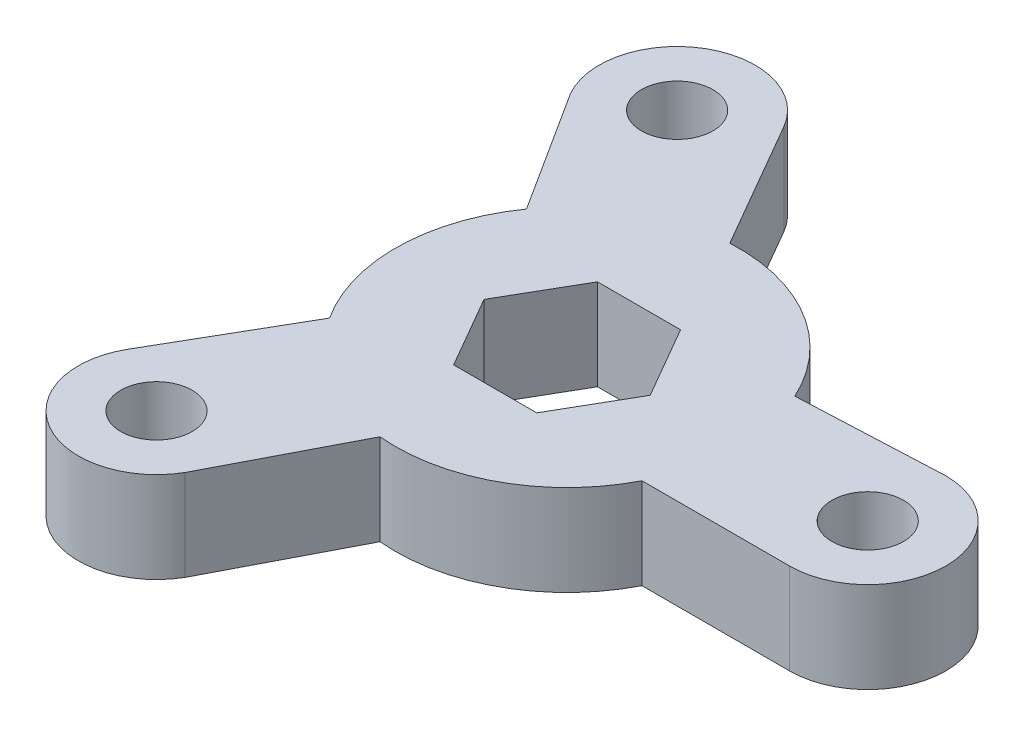
from build123d import *

# Parameters (mm, degrees)
SKETCH1_R           = 1.25
BOSS_EXTRUDE1_DEPTH = 3.175


with BuildPart() as part:
    # Sketch1 → Boss-Extrude1 (new body)
    with BuildSketch(Plane(origin=(0, 0, 0), x_dir=(1, 0, 0), z_dir=(0, 1, 0))):
        with BuildLine():
            ThreePointArc((7.969118099, 2.744709812), (5.624188125, 5.376129638), (2.206241257, 6.236772472))
            Line((2.206241257, 6.236772472), (-0.371989304, 10.702398798))
            ThreePointArc((-0.371989304, 10.702398798), (-4.099660205, 11.701225206), (-5.098486612, 7.973554305))
            Line((-5.098486612, 7.973554305), (-2.377479496, 3.718320719))
            ThreePointArc((-2.377479496, 3.718320719), (-3.483890927, 0.371841879), (-2.520256051, -3.018508355))
            Line((-2.520256051, -3.018508355), (-5.098486612, -7.484134681))
            ThreePointArc((-5.098486612, -7.484134681), (-4.099660205, -11.211805582), (-0.371989304, -10.212979174))
            Line((-0.371989304, -10.212979174), (1.952647522, -5.728901095))
            ThreePointArc((1.952647522, -5.728901095), (5.403988927, -5.013842081), (7.858300919, -2.484134681))
            Line((7.858300919, -2.484134681), (13.014762042, -2.484134681))
            ThreePointArc((13.014762042, -2.484134681), (15.743606535, 0.244709812), (13.014762042, 2.973554305))
            Line((13.014762042, 2.973554305), (7.969118099, 2.744709812))
        make_face()
        Polygon((3.965354593, 2.757209812), (5.415947144, 0.244709812), (3.965354593, -2.267790188), (1.06416949, -2.267790188), (-0.386423061, 0.244709812), (1.06416949, 2.757209812), align=None, mode=Mode.SUBTRACT)
        with Locations((-2.735237958, 9.337976552)):
            Circle(SKETCH1_R, mode=Mode.SUBTRACT)
        with Locations((13.014762042, 0.244709812)):
            Circle(SKETCH1_R, mode=Mode.SUBTRACT)
        with Locations((-2.735237958, -8.848556928)):
            Circle(SKETCH1_R, mode=Mode.SUBTRACT)
    extrude(amount=BOSS_EXTRUDE1_DEPTH)


solid = part.part
